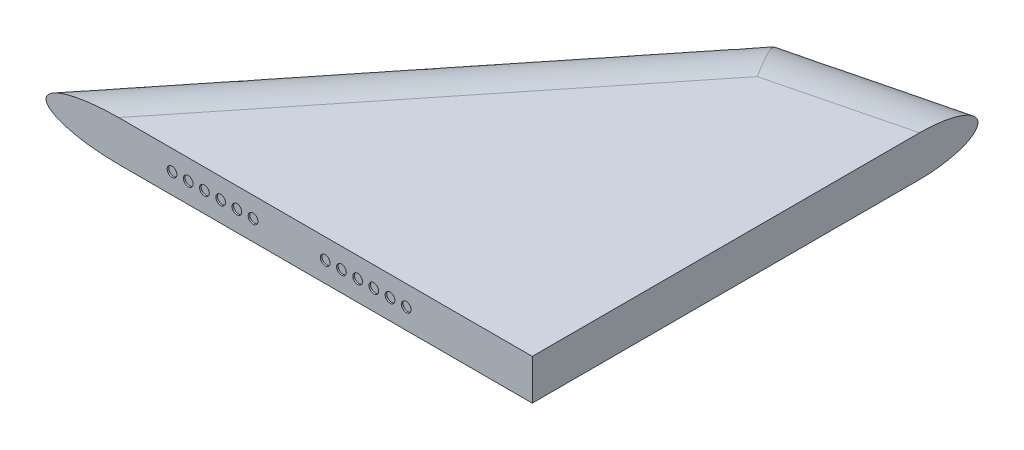
from build123d import *

# Parameters (mm, degrees)
BOSS_EXTRUDE1_DEPTH = 2.5
FILLET3_SIZE        = 2.5
FILLET3_SIZE_2      = 7
FILLET4_SIZE        = 2.5
FILLET4_SIZE_2      = 7
SKETCH2_R           = 0.6
CUT_EXTRUDE1_DEPTH  = 0.2


with BuildPart() as part:
    # Sketch1 → Boss-Extrude1 (new, symmetric)
    with BuildSketch(Plane(origin=(0, 0, 0), x_dir=(1, 0, 0), z_dir=(0, 1, 0))):
        Polygon((0, 0), (40, 50), (60, 55), (60, 0), align=None)
    extrude(amount=BOSS_EXTRUDE1_DEPTH, both=True)

    # Fillet3
    # an asymmetric fillet: 7, 2.5 mm, written as the material it takes off along each edge
    with BuildSketch(Plane(origin=(-10.932163332, 2.5, 13.665204165), x_dir=(0, -1, 0), z_dir=(0.6246950475544242, 0, -0.7808688094430304))) as fillet3_piece_1:
        with BuildLine():
            Bezier((FILLET3_SIZE, 0), (0, 0), (0, -FILLET3_SIZE_2), weights=[1, 0.707106781, 1])
            Line((0, -FILLET3_SIZE_2), (0, 0))
            Line((0, 0), (FILLET3_SIZE, 0))
        make_face()
    extrude(amount=99.031242374, mode=Mode.SUBTRACT)
    with BuildSketch(Plane(origin=(23.022506247, 2.5, -45.755626562), x_dir=(0.24253562503633289, 0, 0.970142500145332), z_dir=(0.970142500145332, 0, -0.2425356250363329))) as fillet3_piece_2:
        with BuildLine():
            Bezier((FILLET3_SIZE_2, 0), (0, 0), (0, FILLET3_SIZE), weights=[1, 0.707106781, 1])
            Line((0, FILLET3_SIZE), (0, 0))
            Line((0, 0), (FILLET3_SIZE_2, 0))
        make_face()
    extrude(amount=55.615528128, mode=Mode.SUBTRACT)

    # Fillet4
    # an asymmetric fillet: 7, 2.5 mm, written as the material it takes off along each edge
    with BuildSketch(Plane(origin=(-10.932163332, -2.5, 13.665204165), x_dir=(0, 1, 0), z_dir=(0.6246950475544242, 0, -0.7808688094430304))) as fillet4_piece_1:
        with BuildLine():
            Bezier((FILLET4_SIZE, 0), (0, 0), (0, FILLET4_SIZE_2), weights=[1, 0.707106781, 1])
            Line((0, FILLET4_SIZE_2), (0, 0))
            Line((0, 0), (FILLET4_SIZE, 0))
        make_face()
    extrude(amount=99.031242374, mode=Mode.SUBTRACT)
    with BuildSketch(Plane(origin=(23.022506247, -2.5, -45.755626562), x_dir=(0, 1, 0), z_dir=(0.970142500145332, 0, -0.2425356250363329))) as fillet4_piece_2:
        with BuildLine():
            Bezier((FILLET4_SIZE, 0), (0, 0), (0, FILLET4_SIZE_2), weights=[1, 0.707106781, 1])
            Line((0, FILLET4_SIZE_2), (0, 0))
            Line((0, 0), (FILLET4_SIZE, 0))
        make_face()
    extrude(amount=55.615528128, mode=Mode.SUBTRACT)

    # Sketch2 → Cut-Extrude1 (cut)
    with BuildSketch(Plane.XY):
        with Locations((15.55, 0)):
            Circle(SKETCH2_R)
        with Locations((17.55, 0)):
            Circle(SKETCH2_R)
        with Locations((19.55, 0)):
            Circle(SKETCH2_R)
        with Locations((21.55, 0)):
            Circle(SKETCH2_R)
        with Locations((23.55, 0)):
            Circle(SKETCH2_R)
        with Locations((25.55, 0)):
            Circle(SKETCH2_R)
        with Locations(Location((34.45, 0, 0), (0, 0, 180))):
            Circle(SKETCH2_R)
        with Locations(Location((36.45, 0, 0), (0, 0, 180))):
            Circle(SKETCH2_R)
        with Locations(Location((38.45, 0, 0), (0, 0, 180))):
            Circle(SKETCH2_R)
        with Locations(Location((40.45, 0, 0), (0, 0, 180))):
            Circle(SKETCH2_R)
        with Locations(Location((42.45, 0, 0), (0, 0, 180))):
            Circle(SKETCH2_R)
        with Locations(Location((44.45, 0, 0), (0, 0, 180))):
            Circle(SKETCH2_R)
    extrude(amount=-CUT_EXTRUDE1_DEPTH, mode=Mode.SUBTRACT)


solid = part.part
